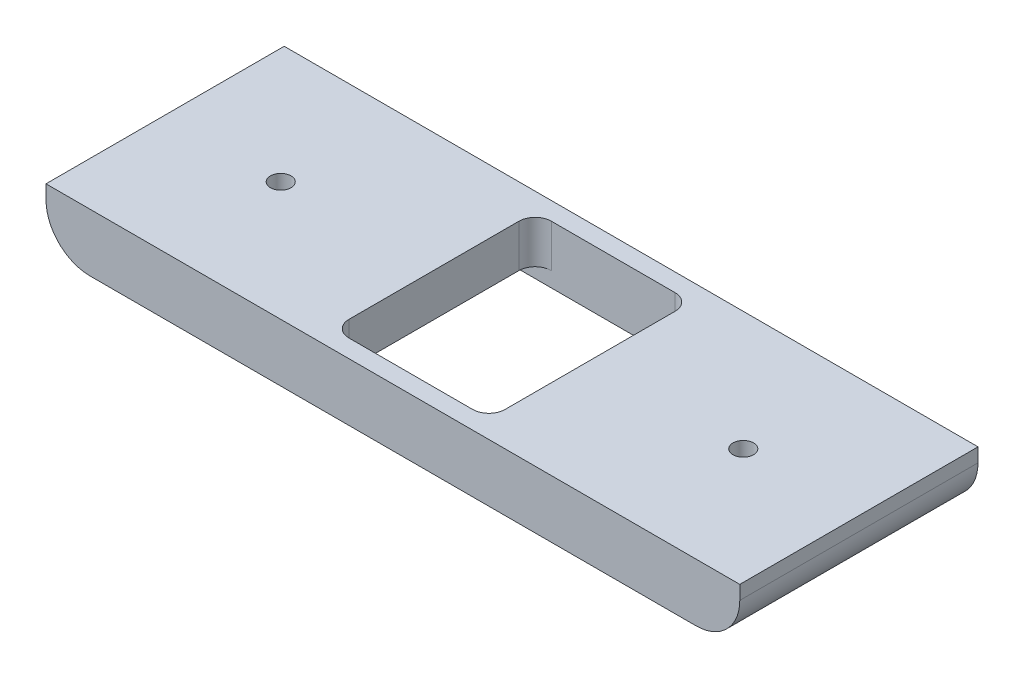
from build123d import *

# Parameters (mm, degrees)
SKETCH1_W               = 76.2
SKETCH1_H               = 26.162
BOSS_EXTRUDE1_DEPTH     = 6.35
FILLET1_R               = 4.826
SKETCH2_W               = 22.225
SKETCH2_H               = 1.651
CUT_EXTRUDE1_DEPTH      = 78.574964138
CUT_EXTRUDE2_DEPTH      = 41.556172921
CUT_EXTRUDE2_DEPTH_BACK = 41.556172921
F_4_40_TAPPED_HOLE1_D   = 2.2606


with BuildPart() as part:
    # Sketch1 → Boss-Extrude1 (new body)
    with BuildSketch(Plane(origin=(0, 0, 0), x_dir=(1, 0, 0), z_dir=(0, 1, 0))):
        Rectangle(SKETCH1_W, SKETCH1_H)
    extrude(amount=BOSS_EXTRUDE1_DEPTH)

    # Fillet1
    fillet1_edges = [part.edges().sort_by_distance(p)[0] for p in [
        (38.1, 0, 0),
        (-38.1, 0, 0),
    ]]
    fillet(fillet1_edges, radius=FILLET1_R)

    # Sketch2 → Cut-Extrude1 (cut, through all)
    with BuildSketch(Plane(origin=(38.1, 0, 0), x_dir=(0, 0, -1), z_dir=(1, 0, 0))):
        with Locations((0, 0.8255)):
            Rectangle(SKETCH2_W, SKETCH2_H)
    extrude(amount=-CUT_EXTRUDE1_DEPTH, mode=Mode.SUBTRACT)

    # Sketch3 → Cut-Extrude2 (cut, two sides: drawn at the far end of the back side and taken through both)
    with BuildSketch(Plane.XZ.offset(-1.651).offset(-CUT_EXTRUDE2_DEPTH_BACK)):
        with BuildLine():
            Line((6.7945, -11.1125), (-6.7945, -11.1125))
            ThreePointArc((-6.7945, -11.1125), (-8.051735857, -10.591735857), (-8.5725, -9.3345))
            Line((-8.5725, -9.3345), (-8.5725, 9.3345))
            ThreePointArc((-8.5725, 9.3345), (-8.051735857, 10.591735857), (-6.7945, 11.1125))
            Line((-6.7945, 11.1125), (6.7945, 11.1125))
            ThreePointArc((6.7945, 11.1125), (8.051735857, 10.591735857), (8.5725, 9.3345))
            Line((8.5725, 9.3345), (8.5725, -9.3345))
            ThreePointArc((8.5725, -9.3345), (8.051735857, -10.591735857), (6.7945, -11.1125))
        make_face()
    extrude(amount=CUT_EXTRUDE2_DEPTH + CUT_EXTRUDE2_DEPTH_BACK, mode=Mode.SUBTRACT)

    # #4-40 Tapped Hole1 (through all)
    with Locations(Plane(origin=(0, 6.35, 0), x_dir=(-1, 0, 0), z_dir=(0, 1, 0))):
        with Locations((25.4, 0), (-25.4, 0)):
            Hole(F_4_40_TAPPED_HOLE1_D / 2)


solid = part.part
